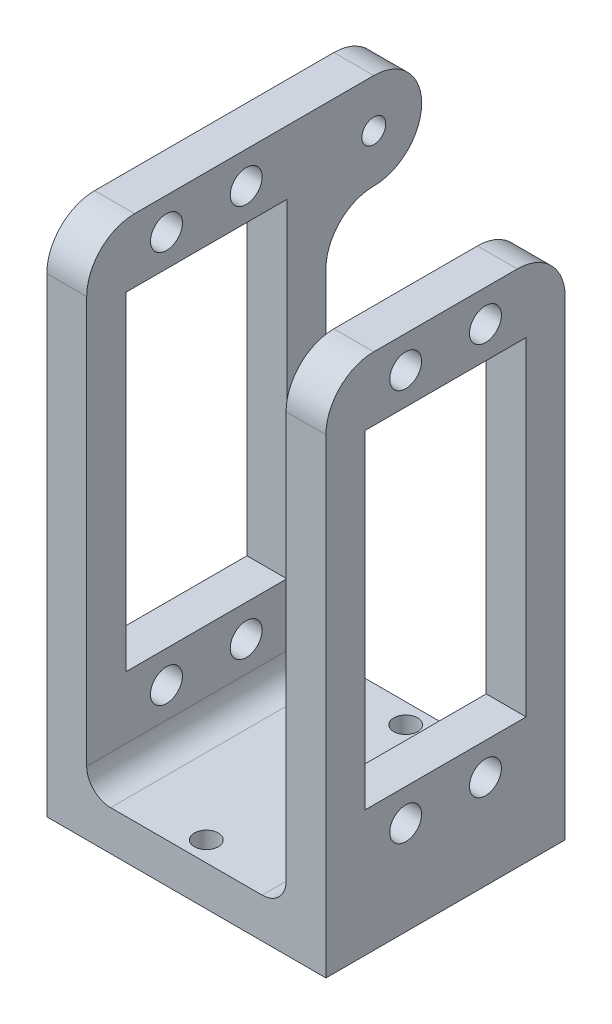
from build123d import *

# Parameters (mm, degrees)
SKETCH1_W           = 35
SKETCH1_H           = 30
BOSS_EXTRUDE3_DEPTH = 5
SKETCH5_W           = 5
SKETCH5_H           = 30
BOSS_EXTRUDE4_DEPTH = 60
SKETCH6_R           = 2
SKETCH6_W           = 20.2
SKETCH6_H           = 41.2
CUT_EXTRUDE1_DEPTH  = 60
FILLET2_R           = 3
BOSS_EXTRUDE7_DEPTH = 5
FILLET3_R           = 6
SKETCH10_R          = 1.5
CUT_EXTRUDE2_DEPTH  = 5
FILLET4_R           = 6


with BuildPart() as part:
    # Sketch1 → Boss-Extrude3 (new body)
    with BuildSketch(Plane(origin=(0, 0, 0), x_dir=(1, 0, 0), z_dir=(0, 1, 0))):
        with Locations((17.5, 15)):
            Rectangle(SKETCH1_W, SKETCH1_H)
    extrude(amount=BOSS_EXTRUDE3_DEPTH)

    # Sketch5 → Boss-Extrude4 (add)
    with BuildSketch(Plane(origin=(0, 5, 0), x_dir=(1, 0, 0), z_dir=(0, 1, 0))):
        with Locations((2.5, 15)):
            Rectangle(SKETCH5_W, SKETCH5_H)
        with Locations((32.5, 15)):
            Rectangle(SKETCH5_W, SKETCH5_H)
    extrude(amount=BOSS_EXTRUDE4_DEPTH)

    # Sketch6 → Cut-Extrude1 (cut)
    with BuildSketch(Plane(origin=(35, 0, 0), x_dir=(0, 0, -1), z_dir=(1, 0, 0))):
        with Locations((10, 61)):
            Circle(SKETCH6_R)
        with Locations((20, 61)):
            Circle(SKETCH6_R)
        with Locations((10, 11.8)):
            Circle(SKETCH6_R)
        with Locations((20, 11.8)):
            Circle(SKETCH6_R)
        with Locations((15, 36.4)):
            Rectangle(SKETCH6_W, SKETCH6_H)
    extrude(amount=-CUT_EXTRUDE1_DEPTH, mode=Mode.SUBTRACT)

    # Fillet2
    fillet2_edges = [part.edges().sort_by_distance(p)[0] for p in [
        (5, 5, -15),
        (30, 5, -15),
    ]]
    fillet(fillet2_edges, radius=FILLET2_R)

    # Sketch8 → Boss-Extrude7 (add)
    with BuildSketch(Plane.ZY):
        with BuildLine():
            ThreePointArc((-30, 59), (-31.757359313, 63.242640687), (-36, 65))
            Line((-36, 65), (-36, 60.5))
            ThreePointArc((-36, 60.5), (-34.939339828, 60.060660172), (-34.5, 59))
            ThreePointArc((-34.5, 59), (-34.939339828, 57.939339828), (-36, 57.5))
            Line((-36, 57.5), (-36, 53))
            ThreePointArc((-36, 53), (-31.757359313, 54.757359313), (-30, 59))
        make_face()
        with BuildLine():
            Line((-36, 60.5), (-36, 65))
            ThreePointArc((-36, 65), (-42, 59), (-36, 53))
            Line((-36, 53), (-36, 57.5))
            ThreePointArc((-36, 57.5), (-37.5, 59), (-36, 60.5))
        make_face()
        with BuildLine():
            Line((-30, 59), (-30, 65))
            Line((-30, 65), (-36, 65))
            ThreePointArc((-36, 65), (-31.757359313, 63.242640687), (-30, 59))
        make_face()
        with BuildLine():
            Line((-30, 53), (-30, 59))
            ThreePointArc((-30, 59), (-31.757359313, 54.757359313), (-36, 53))
            Line((-36, 53), (-30, 53))
        make_face()
    extrude(amount=-BOSS_EXTRUDE7_DEPTH)

    # Fillet3
    fillet3_edges = [part.edges().sort_by_distance(p)[0] for p in [
        (2.5, 53, -30),
    ]]
    fillet(fillet3_edges, radius=FILLET3_R - 0.0001)  # a hair under: the kernel refuses the full size

    # Sketch10 → Cut-Extrude2 (cut)
    with BuildSketch(Plane(origin=(0, 5, 0), x_dir=(1, 0, 0), z_dir=(0, 1, 0))):
        with Locations(Location((17.5, 27.5, 0), (0, 0, 270))):
            Circle(SKETCH10_R)
        with Locations(Location((17.5, 2.5, 0), (0, 0, 270))):
            Circle(SKETCH10_R)
    extrude(amount=-CUT_EXTRUDE2_DEPTH, mode=Mode.SUBTRACT)

    # Fillet4
    fillet4_edges = [part.edges().sort_by_distance(p)[0] for p in [
        (2.5, 65, 0),
        (32.5, 65, -30),
        (32.5, 65, 0),
    ]]
    fillet(fillet4_edges, radius=FILLET4_R)


solid = part.part
